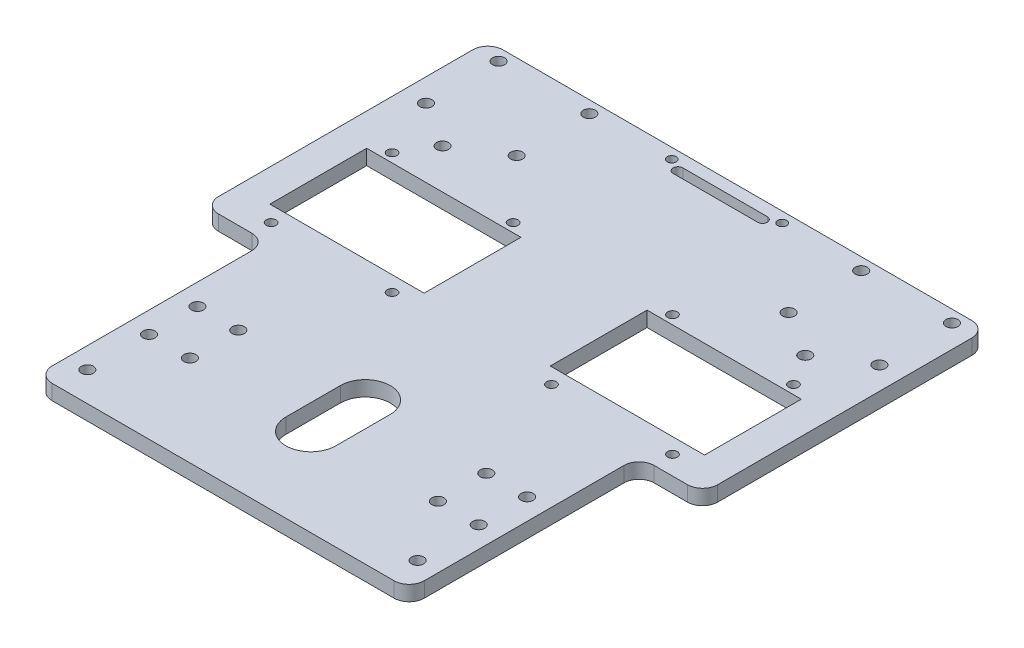
from build123d import *

# Parameters (mm, degrees)
BOSS_EXTRUDE2_DEPTH = 5
FILLET8_R           = 5
FILLET9_R           = 5
SKETCH4_R           = 2
SKETCH4_R_2         = 1.605
SKETCH4_R_3         = 1.5
SKETCH4_W           = 51
SKETCH4_H           = 32
CUT_EXTRUDE1_DEPTH  = 5


with BuildPart() as part:
    # Sketch1 → Boss-Extrude2 (new body)
    with BuildSketch(Plane(origin=(0, 0, 0), x_dir=(1, 0, 0), z_dir=(0, 1, 0))):
        Polygon((82.5, 85), (-82.5, 85), (-82.5, -9), (-61.5, -9), (-61.5, -85), (61.5, -85), (61.5, -9), (82.5, -9), align=None)
    extrude(amount=BOSS_EXTRUDE2_DEPTH)

    # Fillet8
    fillet8_edges = [part.edges().sort_by_distance(p)[0] for p in [
        (82.5, 2.5, -85),
        (-82.5, 2.5, -85),
    ]]
    fillet(fillet8_edges, radius=FILLET8_R)

    # Fillet9
    fillet9_edges = [part.edges().sort_by_distance(p)[0] for p in [
        (82.5, 2.5, 9),
        (61.5, 2.5, 9),
        (61.5, 2.5, 85),
        (-61.5, 2.5, 85),
        (-61.5, 2.5, 9),
        (-82.5, 2.5, 9),
    ]]
    fillet(fillet9_edges, radius=FILLET9_R)

    # Sketch4 → Cut-Extrude1 (cut)
    with BuildSketch(Plane(origin=(0, 5, 0), x_dir=(1, 0, 0), z_dir=(0, 1, 0))):
        with Locations((-41, -39)):
            Circle(SKETCH4_R)
        with Locations((41, -39)):
            Circle(SKETCH4_R)
        with Locations((41, -55)):
            Circle(SKETCH4_R)
        with Locations((-41, -55)):
            Circle(SKETCH4_R)
        with Locations((-54.5, -39)):
            Circle(SKETCH4_R)
        with Locations((-54.5, -55)):
            Circle(SKETCH4_R)
        with Locations((54.5, -55)):
            Circle(SKETCH4_R)
        with Locations((54.5, -39)):
            Circle(SKETCH4_R)
        with Locations((-66.347425201, 37.2)):
            Circle(SKETCH4_R_2)
        with Locations((-26.347425201, 37.2)):
            Circle(SKETCH4_R_2)
        with Locations((-66.347425201, -2.8)):
            Circle(SKETCH4_R_2)
        with Locations((-26.347425201, -2.8)):
            Circle(SKETCH4_R_2)
        with Locations((66.347425201, -2.8)):
            Circle(SKETCH4_R_2)
        with Locations((26.347425201, -2.8)):
            Circle(SKETCH4_R_2)
        with Locations((26.347425201, 37.2)):
            Circle(SKETCH4_R_2)
        with Locations((66.347425201, 37.2)):
            Circle(SKETCH4_R_2)
        with Locations((44.944985608, 81)):
            Circle(SKETCH4_R)
        with Locations((74.944985608, 81)):
            Circle(SKETCH4_R)
        with Locations((74.944985608, 57)):
            Circle(SKETCH4_R)
        with Locations((44.944985608, 57)):
            Circle(SKETCH4_R)
        with Locations((-74.944985608, 81)):
            Circle(SKETCH4_R)
        with Locations((-74.944985608, 57)):
            Circle(SKETCH4_R)
        with Locations((-44.944985608, 57)):
            Circle(SKETCH4_R)
        with Locations((-44.944985608, 81)):
            Circle(SKETCH4_R)
        with Locations((-18.25, 81.571935724)):
            Circle(SKETCH4_R_3)
        with Locations((18.25, 81.571935724)):
            Circle(SKETCH4_R_3)
        with Locations((-59.944985608, 47.5)):
            Circle(SKETCH4_R)
        with Locations((-54.599046458, -75.296312774)):
            Circle(SKETCH4_R)
        with Locations((54.599046458, -75.296312774)):
            Circle(SKETCH4_R)
        with Locations((59.944985608, 47.5)):
            Circle(SKETCH4_R)
        with BuildLine():
            Line((8.255924755, -38), (8.255924755, -56))
            ThreePointArc((8.255924755, -56), (0, -64.255924755), (-8.255924755, -56))
            Line((-8.255924755, -56), (-8.255924755, -38))
            ThreePointArc((-8.255924755, -38), (0, -29.744075245), (8.255924755, -38))
        make_face()
        with Locations((-46.347425201, 18.3)):
            Rectangle(SKETCH4_W, SKETCH4_H)
        with Locations((46.347425201, 18.3)):
            Rectangle(SKETCH4_W, SKETCH4_H)
        with BuildLine():
            Line((-13.97, 80.942882459), (13.97, 80.942882459))
            ThreePointArc((13.97, 80.942882459), (15.570946735, 79.341935724), (13.97, 77.740988989))
            Line((13.97, 77.740988989), (-13.97, 77.740988989))
            ThreePointArc((-13.97, 77.740988989), (-15.570946735, 79.341935724), (-13.97, 80.942882459))
        make_face()
    extrude(amount=-CUT_EXTRUDE1_DEPTH, mode=Mode.SUBTRACT)


solid = part.part
